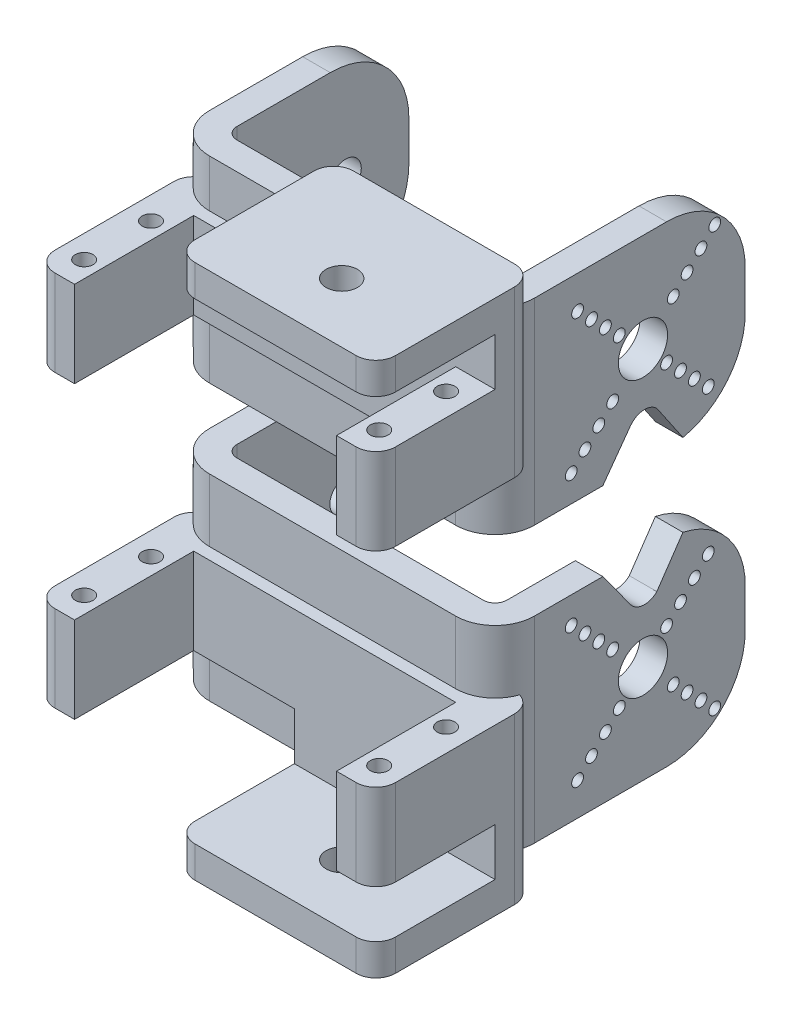
from build123d import *

# Parameters (mm, degrees)
BOSS_EXTRUDE1_DEPTH      = 50
FILLET2_R                = 20
SKETCH6_R                = 1.5
CUT_EXTRUDE2_DEPTH       = 28.4
CUT_EXTRUDE3_DEPTH       = 136.4
CUT_EXTRUDE4_DEPTH       = 116.893533958
CUT_EXTRUDE4_DEPTH_BACK  = 26.4
BOSS_EXTRUDE2_DEPTH      = 21.9
BOSS_EXTRUDE3_DEPTH      = 12.1
BOSS_EXTRUDE4_DEPTH      = 8
CUT_EXTRUDE5_START       = 12.1
CUT_EXTRUDE5_OUTLINE_R   = 2.25
CUT_EXTRUDE5_DEPTH       = 21.9
CUT_EXTRUDE5_START_2     = -8
CUT_EXTRUDE5_2_OUTLINE_R = 4
CUT_EXTRUDE5_2_DEPTH     = 8


# Read off the part's stored shape, not the designer's step: Cut-Extrude5
with BuildPart() as part:
    # Sketch1 → Boss-Extrude1 (new body)
    with BuildSketch(Plane(origin=(0, 0, 0), x_dir=(1, 0, 0), z_dir=(0, 1, 0))):
        with BuildLine():
            Line((-56.375697839, 54.197981352), (-56.375697839, 10.497981352))
            ThreePointArc((-56.375697839, 10.497981352), (-53.44676565, 3.42691354), (-46.375697839, 0.497981352))
            Line((-46.375697839, 0.497981352), (16.224302161, 0.497981352))
            ThreePointArc((16.224302161, 0.497981352), (23.295369973, 3.42691354), (26.224302161, 10.497981352))
            Line((26.224302161, 10.497981352), (26.224302161, 64.097981352))
            Line((26.224302161, 64.097981352), (19.224302161, 64.097981352))
            Line((19.224302161, 64.097981352), (19.224302161, 10.497981352))
            ThreePointArc((19.224302161, 10.497981352), (18.345622505, 8.376661008), (16.224302161, 7.497981352))
            Line((16.224302161, 7.497981352), (-46.375697839, 7.497981352))
            ThreePointArc((-46.375697839, 7.497981352), (-48.497018182, 8.376661008), (-49.375697839, 10.497981352))
            Line((-49.375697839, 10.497981352), (-49.375697839, 54.197981352))
            Line((-49.375697839, 54.197981352), (-56.375697839, 54.197981352))
        make_face()
    extrude(amount=BOSS_EXTRUDE1_DEPTH)

    # Fillet2
    fillet2_edges = [part.edges().sort_by_distance(p)[0] for p in [
        (22.724302161, 0, -64.097981352),
        (-52.875697839, 0, -54.197981352),
        (22.724302161, 50, -64.097981352),
        (-52.875697839, 50, -54.197981352),
    ]]
    fillet(fillet2_edges, radius=FILLET2_R)

    # Sketch6 → Cut-Extrude2 (cut)
    with BuildSketch(Plane(origin=(26.224302161, 0, 0), x_dir=(0, 0, -1), z_dir=(1, 0, 0))):
        with BuildLine():
            ThreePointArc((34.097981352, 25), (38.097981352, 21), (42.097981352, 25))
            Line((42.097981352, 25), (34.097981352, 25))
        make_face()
        with BuildLine():
            Line((34.097981352, 25), (42.097981352, 25))
            ThreePointArc((42.097981352, 25), (38.097981352, 29), (34.097981352, 25))
        make_face()
        with BuildLine():
            ThreePointArc((31.836343923, 25), (38.097981352, 18.738362572), (44.35961878, 25))
            Line((44.35961878, 25), (42.097981352, 25))
            ThreePointArc((42.097981352, 25), (38.097981352, 21), (34.097981352, 25))
            Line((34.097981352, 25), (31.836343923, 25))
        make_face()
        with BuildLine():
            Line((42.097981352, 25), (44.35961878, 25))
            ThreePointArc((44.35961878, 25), (38.097981352, 31.261637428), (31.836343923, 25))
            Line((31.836343923, 25), (34.097981352, 25))
            ThreePointArc((34.097981352, 25), (38.097981352, 29), (42.097981352, 25))
        make_face()
        with Locations((30.390517437, 32.707463915)):
            Circle(SKETCH6_R)
        with Locations((26.876196734, 36.221784617)):
            Circle(SKETCH6_R)
        with Locations((23.354804964, 39.743176388)):
            Circle(SKETCH6_R)
        with Locations((19.854626397, 43.243354955)):
            Circle(SKETCH6_R)
        with Locations((44.108388992, 31.01040764)):
            Circle(SKETCH6_R)
        with Locations((47.643922898, 34.545941546)):
            Circle(SKETCH6_R)
        with Locations((51.179456803, 38.081475452)):
            Circle(SKETCH6_R)
        with Locations((54.714990709, 41.617009358)):
            Circle(SKETCH6_R)
        with Locations((45.805445266, 17.292536085)):
            Circle(SKETCH6_R)
        with Locations((49.319765969, 13.778215383)):
            Circle(SKETCH6_R)
        with Locations((52.841157739, 10.256823612)):
            Circle(SKETCH6_R)
        with Locations((56.341336306, 6.756645045)):
            Circle(SKETCH6_R)
        with Locations((32.087573711, 18.98959236)):
            Circle(SKETCH6_R)
        with Locations((28.552039805, 15.454058454)):
            Circle(SKETCH6_R)
        with Locations((25.0165059, 11.918524548)):
            Circle(SKETCH6_R)
        with Locations((21.480971994, 8.382990642)):
            Circle(SKETCH6_R)
    extrude(amount=-CUT_EXTRUDE2_DEPTH, mode=Mode.SUBTRACT)

    # Sketch6<3> → Cut-Extrude3 (cut)
    with BuildSketch(Plane(origin=(26.224302161, 0, 0), x_dir=(0, 0, -1), z_dir=(1, 0, 0))):
        with BuildLine():
            ThreePointArc((34.097981352, 25), (38.097981352, 21), (42.097981352, 25))
            Line((42.097981352, 25), (34.097981352, 25))
        make_face()
        with BuildLine():
            Line((34.097981352, 25), (42.097981352, 25))
            ThreePointArc((42.097981352, 25), (38.097981352, 29), (34.097981352, 25))
        make_face()
    extrude(amount=-CUT_EXTRUDE3_DEPTH, mode=Mode.SUBTRACT)

    # Sketch7 → Cut-Extrude4 (cut, two sides: drawn at the far end of the back side and taken through both)
    with BuildSketch(Plane(origin=(26.224302161, 0, 0), x_dir=(0, 0, -1), z_dir=(1, 0, 0)).offset(-CUT_EXTRUDE4_DEPTH_BACK)):
        with BuildLine():
            Line((44.097981352, 50), (27.901409821, 50))
            Line((27.901409821, 50), (34.889942889, 40.363586132))
            ThreePointArc((34.889942889, 40.363586132), (38.136702541, 38.542544558), (41.629478365, 39.830239282))
            Line((41.629478365, 39.830239282), (48.26230961, 49.561655609))
            ThreePointArc((48.26230961, 49.561655609), (46.191648926, 49.890112018), (44.097981352, 50))
        make_face()
    extrude(amount=CUT_EXTRUDE4_DEPTH + CUT_EXTRUDE4_DEPTH_BACK, mode=Mode.SUBTRACT)

    # Sketch8 → Boss-Extrude2 (add)
    with BuildSketch(Plane(origin=(0, 34, 0), x_dir=(1, 0, 0), z_dir=(0, 1, 0))):
        with BuildLine():
            Line((-52.375697839, 7.497981352), (24.224302161, 7.497981352))
            ThreePointArc((24.224302161, 7.497981352), (27.759836067, 6.033515257), (29.224302161, 2.497981352))
            Line((29.224302161, 2.497981352), (29.224302161, -27.802018648))
            ThreePointArc((29.224302161, -27.802018648), (27.759836067, -31.337552554), (24.224302161, -32.802018648))
            Line((24.224302161, -32.802018648), (19.224302161, -32.802018648))
            Line((19.224302161, -32.802018648), (19.224302161, -2.502018648))
            Line((19.224302161, -2.502018648), (-47.375697839, -2.502018648))
            Line((-47.375697839, -2.502018648), (-47.375697839, -32.802018648))
            Line((-47.375697839, -32.802018648), (-52.375697839, -32.802018648))
            ThreePointArc((-52.375697839, -32.802018648), (-55.911231744, -31.337552554), (-57.375697839, -27.802018648))
            Line((-57.375697839, -27.802018648), (-57.375697839, 2.497981352))
            ThreePointArc((-57.375697839, 2.497981352), (-55.911231744, 6.033515257), (-52.375697839, 7.497981352))
        make_face()
    extrude(amount=-BOSS_EXTRUDE2_DEPTH)

    # Sketch9 → Boss-Extrude3 (add)
    with BuildSketch(Plane.XZ.offset(-12.1)):
        with BuildLine():
            Line((19.224302161, 2.502018648), (-21.775697839, 2.502018648))
            Line((-21.775697839, 2.502018648), (-21.775697839, -0.497981352))
            Line((-21.775697839, -0.497981352), (16.224302161, -0.497981352))
            ThreePointArc((16.224302161, -0.497981352), (22.046605586, -2.367742558), (25.691645595, -7.277824785))
            ThreePointArc((25.691645595, -7.277824785), (28.245291913, -5.469789121), (29.224302161, -2.497981352))
            Line((29.224302161, -2.497981352), (29.224302161, 2.502018648))
            Line((29.224302161, 2.502018648), (19.224302161, 2.502018648))
        make_face()
    extrude(amount=BOSS_EXTRUDE3_DEPTH)

    # Sketch10 → Boss-Extrude4 (add)
    with BuildSketch(Plane.XZ):
        with BuildLine():
            Line((24.224302161, 32.802018648), (-16.775697839, 32.802018648))
            ThreePointArc((-16.775697839, 32.802018648), (-20.311231744, 31.337552554), (-21.775697839, 27.802018648))
            Line((-21.775697839, 27.802018648), (-21.775697839, -2.497981352))
            ThreePointArc((-21.775697839, -2.497981352), (-20.311231744, -6.033515257), (-16.775697839, -7.497981352))
            Line((-16.775697839, -7.497981352), (24.224302161, -7.497981352))
            ThreePointArc((24.224302161, -7.497981352), (27.759836067, -6.033515257), (29.224302161, -2.497981352))
            Line((29.224302161, -2.497981352), (29.224302161, 27.802018648))
            ThreePointArc((29.224302161, 27.802018648), (27.759836067, 31.337552554), (24.224302161, 32.802018648))
        make_face()
    extrude(amount=BOSS_EXTRUDE4_DEPTH)

    # Cut-Extrude5 outline → Cut-Extrude5 (cut)
    with BuildSketch(Plane(origin=(0, 0, 0), x_dir=(1, 0, 0), z_dir=(0, 1, 0)).offset(CUT_EXTRUDE5_START)):
        with Locations((23.424302161, -26.152018648)):
            Circle(CUT_EXTRUDE5_OUTLINE_R)
        with Locations((23.424302161, -9.152018648)):
            Circle(CUT_EXTRUDE5_OUTLINE_R)
        with Locations((-51.575697839, -9.152018648)):
            Circle(CUT_EXTRUDE5_OUTLINE_R)
        with Locations((-51.575697839, -26.152018648)):
            Circle(CUT_EXTRUDE5_OUTLINE_R)
    extrude(amount=CUT_EXTRUDE5_DEPTH, mode=Mode.SUBTRACT)

    # Cut-Extrude5 2 outline → Cut-Extrude5 2 (cut)
    with BuildSketch(Plane(origin=(0, 0, 0), x_dir=(1, 0, 0), z_dir=(0, 1, 0)).offset(CUT_EXTRUDE5_START_2)):
        with Locations((5.396574982, -17.653309847)):
            Circle(CUT_EXTRUDE5_2_OUTLINE_R)
    extrude(amount=CUT_EXTRUDE5_2_DEPTH, mode=Mode.SUBTRACT)


with BuildPart() as body_2:
    # Mirror3: mirrored copy
    add(part.part.mirror(Plane.ZX.offset(60)))


solid = Compound([part.part, body_2.part])
